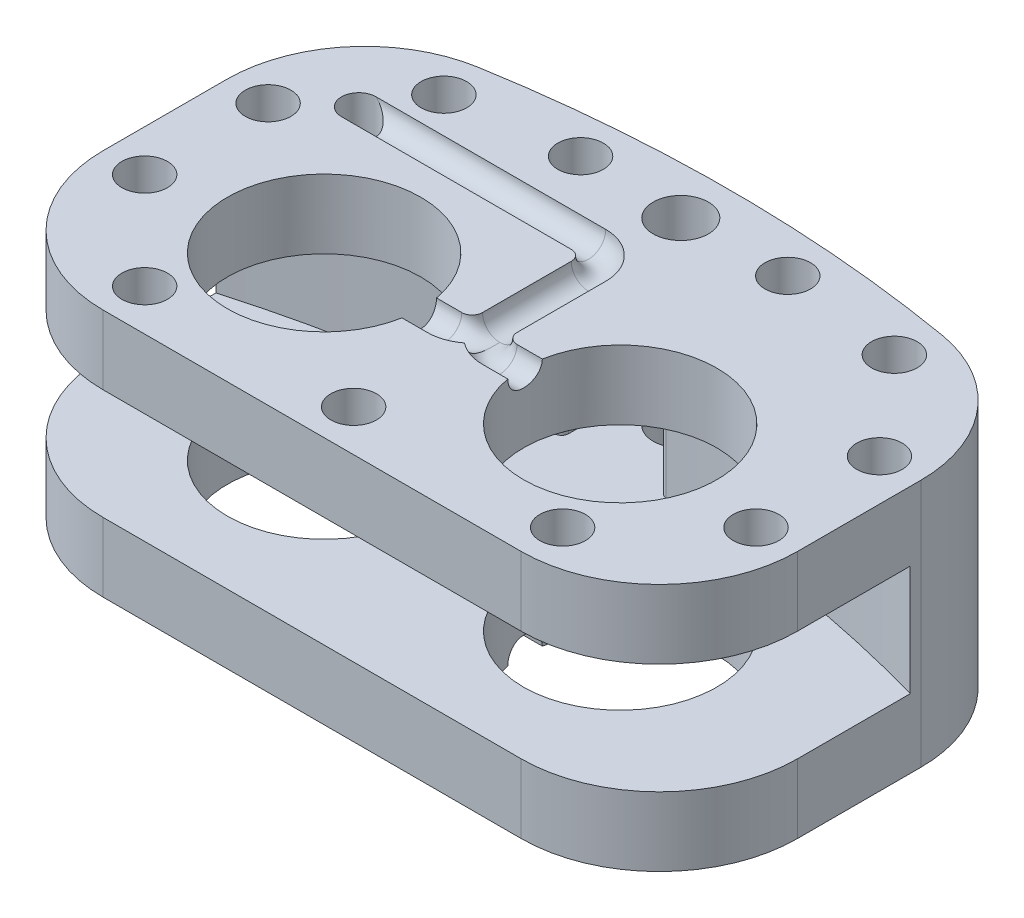
from build123d import *

# Parameters (mm, degrees)
BOSS_EXTRUDE1_DEPTH             = 5
F_12_0MM_DOWEL_HOLE1_D          = 14
BOSS_EXTRUDE2_DEPTH             = 4
F_4_0MM_DOWEL_HOLE1_D           = 4
SKETCH13_R                      = 1.25
SKETCH13_4_R                    = 1.25
M4X0_7_TAPPED_HOLE2_D           = 3.3
M4X0_7_TAPPED_HOLE2_DEPTH       = 8
M4X0_7_TAPPED_HOLE2_TIP         = 0.991420021
FILLET1_R                       = 10
M4X0_7_TAPPED_HOLE1_AT_2_COUNT  = 2
M4X0_7_TAPPED_HOLE1_AT_2_PITCH  = 25.073446611
M4X0_7_TAPPED_HOLE1_AT_3_COUNT  = 2
M4X0_7_TAPPED_HOLE1_AT_3_PITCH  = 32.930809617
M4X0_7_TAPPED_HOLE1_AT_4_COUNT  = 2
M4X0_7_TAPPED_HOLE1_AT_4_PITCH  = 25.111924527
M4X0_7_TAPPED_HOLE1_AT_5_COUNT  = 2
M4X0_7_TAPPED_HOLE1_AT_5_PITCH  = 22.370502293
M4X0_7_TAPPED_HOLE1_AT_6_COUNT  = 2
M4X0_7_TAPPED_HOLE1_AT_6_PITCH  = 16.667429732
M4X0_7_TAPPED_HOLE1_AT_7_COUNT  = 2
M4X0_7_TAPPED_HOLE1_AT_7_PITCH  = 8.870903554
M4X0_7_TAPPED_HOLE1_AT_8_COUNT  = 2
M4X0_7_TAPPED_HOLE1_AT_8_PITCH  = 23.828688167
M4X0_7_TAPPED_HOLE1_AT_9_COUNT  = 2
M4X0_7_TAPPED_HOLE1_AT_9_PITCH  = 30.686033996
M4X0_7_TAPPED_HOLE1_AT_10_COUNT = 2
M4X0_7_TAPPED_HOLE1_AT_10_PITCH = 34.121383931
M4X0_7_TAPPED_HOLE1_AT_11_COUNT = 2
M4X0_7_TAPPED_HOLE1_AT_11_PITCH = 15
FILLET2_R                       = 0.5


with BuildPart() as part:
    # Sketch2 → Boss-Extrude1 (new body)
    with BuildSketch(Plane(origin=(0, 0, 0), x_dir=(1, 0, 0), z_dir=(0, 1, 0))):
        with BuildLine():
            Line((-25.127648951, 69.819630142), (25.127648951, 69.819630142))
            Line((25.127648951, 69.819630142), (25.127648951, 96.828075976))
            ThreePointArc((25.127648951, 96.828075976), (0, 100.035368941), (-25.127648951, 96.828075976))
            Line((-25.127648951, 96.828075976), (-25.127648951, 69.819630142))
        make_face()
    boss_extrude1 = extrude(amount=BOSS_EXTRUDE1_DEPTH)

    # Ø12.0mm Dowel Hole1 (through all)
    with Locations(Plane(origin=(0, 5, 0), x_dir=(1, 0, 0), z_dir=(0, 1, 0))):
        with Locations((-10.716200381, 81.397623119), (10.716200381, 81.397623119)):
            f_12_0mm_dowel_hole1 = Hole(F_12_0MM_DOWEL_HOLE1_D / 2)

    # Sketch6 → Boss-Extrude2 (add)
    with BuildSketch(Plane(origin=(0, 5, 0), x_dir=(1, 0, 0), z_dir=(0, 1, 0))):
        with BuildLine():
            Line((-3.535368944, 91.431674853), (-3.535368944, 99.972877349))
            ThreePointArc((-3.535368944, 99.972877349), (-14.417509932, 98.990961438), (-25.127648951, 96.828075976))
            Line((-25.127648951, 96.828075976), (-25.127648951, 87.982107603))
            ThreePointArc((-25.127648951, 87.982107603), (-14.434923875, 90.354208384), (-3.535368944, 91.431674853))
        make_face()
        with BuildLine():
            Line((3.535368944, 91.431674853), (3.535368944, 99.972877349))
            ThreePointArc((3.535368944, 99.972877349), (14.417509932, 98.990961438), (25.127648951, 96.828075976))
            Line((25.127648951, 96.828075976), (25.127648951, 87.982107603))
            ThreePointArc((25.127648951, 87.982107603), (14.434923875, 90.354208384), (3.535368944, 91.431674853))
        make_face()
    boss_extrude2 = extrude(amount=BOSS_EXTRUDE2_DEPTH)

    # Ø4.0mm Dowel Hole1 (through all)
    with Locations(Plane(origin=(0, 5, 0), x_dir=(1, 0, 0), z_dir=(0, 1, 0))):
        with Locations((0, 96.5)):
            f_4_0mm_dowel_hole1 = Hole(F_4_0MM_DOWEL_HOLE1_D / 2)

    # Cut-Sweep6: sweep along a curve in space
    with BuildLine() as cut_sweep6_path:
        Line((2, 0, -81.397623119), (10.716200381, 0, -81.397623119))
        ThreePointArc((0, 0, -83.397623119), (0.585786438, 0, -81.983409556), (2, 0, -81.397623119))
        Line((0, 0, -89.819630142), (0, 0, -83.397623119))
        ThreePointArc((-2, 0, -91.819630142), (-0.585786438, 0, -91.233843704), (0, 0, -89.819630142))
        Line((-18.627648951, 0, -91.819630142), (-2, 0, -91.819630142))
        Line((-18.627648951, 0, -91.819630142), (-18.627648951, 9, -91.819630142))
        Line((-18.627648951, 9, -91.819630142), (-25.127648951, 9, -96.828075976))
    # Sketch13 → Cut-Sweep6 (sweep, cut)
    with BuildSketch(Plane(origin=(-13.627648951, 0, 0), x_dir=(0, 0, -1), z_dir=(1, 0, 0))):
        with Locations((91.819630142, 0)):
            Circle(SKETCH13_R)
    cut_sweep6 = sweep(path=cut_sweep6_path.line, transition=Transition.RIGHT, mode=Mode.SUBTRACT)

    # Cut-Sweep7: sweep along a path in Sketch9
    with BuildLine(Plane.XZ) as cut_sweep7_path:
        Line((-10.716200381, -81.397623119), (-2, -81.397623119))
        ThreePointArc((-2, -81.397623119), (-0.585786438, -81.983409556), (0, -83.397623119))
        Line((0, -83.397623119), (0, -89.819630142))
        ThreePointArc((0, -89.819630142), (-0.585786438, -91.233843704), (-2, -91.819630142))
        Line((-2, -91.819630142), (-18.627648951, -91.819630142))
    # Sketch13<4> → Cut-Sweep7 (sweep, cut)
    with BuildSketch(Plane(origin=(-13.627648951, 0, 0), x_dir=(0, 0, -1), z_dir=(1, 0, 0))):
        with Locations((91.819630142, 0)):
            Circle(SKETCH13_4_R)
    cut_sweep7 = sweep(path=cut_sweep7_path.line, mode=Mode.SUBTRACT)

    # Mirror5: Boss-Extrude2 across plane
    add(boss_extrude2.mirror(Plane.ZX.offset(9)))

    # Mirror6: Boss-Extrude1, Ø12.0mm Dowel Hole1, Ø4.0mm Dowel Hole1, Cut-Sweep6, Cut-Sweep7 across plane
    add(boss_extrude1.mirror(Plane.ZX.offset(9)))
    add(f_12_0mm_dowel_hole1.mirror(Plane.ZX.offset(9)), mode=Mode.SUBTRACT)
    add(f_4_0mm_dowel_hole1.mirror(Plane.ZX.offset(9)), mode=Mode.SUBTRACT)
    add(cut_sweep6.mirror(Plane.ZX.offset(9)), mode=Mode.SUBTRACT)
    add(cut_sweep7.mirror(Plane.ZX.offset(9)), mode=Mode.SUBTRACT)

    # M4x0.7 Tapped Hole2
    with Locations(Plane(origin=(-25.127648951, 9, -96.828075976), x_dir=(-0.6103571912447526, 0, 0.7921263151138311), z_dir=(-0.7921263151138311, 0, -0.6103571912447526))):
        with Locations((0, 0)):
            Hole(M4X0_7_TAPPED_HOLE2_D / 2, depth=M4X0_7_TAPPED_HOLE2_DEPTH)
            with Locations((0, 0, -(M4X0_7_TAPPED_HOLE2_DEPTH + M4X0_7_TAPPED_HOLE2_TIP / 2))):  # 118° drill point
                Cone(0, M4X0_7_TAPPED_HOLE2_D / 2, M4X0_7_TAPPED_HOLE2_TIP, mode=Mode.SUBTRACT)

    # Fillet1
    # the kernel refuses this fillet: 10 mm, written as the material it takes off along each edge
    with BuildSketch(Plane(origin=(25.127648951, 43, -69.819630142), x_dir=(0, 0, -1), z_dir=(0, -1, 0)), Plane(origin=(-25.127648951, -25, -69.819630142), x_dir=(0, 0, -1), z_dir=(0, 1, 0))) as fillet1_piece_1:
        with BuildLine():
            CenterArc((FILLET1_R, -FILLET1_R), FILLET1_R, 90, 90)
            Line((0, -FILLET1_R), (0, 0))
            Line((0, 0), (FILLET1_R, 0))
        make_face()
    extrude(amount=55, mode=Mode.SUBTRACT)
    with BuildSketch(Plane(origin=(-25.127648951, 43, -69.819630142), x_dir=(0, 0, -1), z_dir=(0, -1, 0)), Plane(origin=(25.127648951, -25, -69.819630142), x_dir=(0, 0, -1), z_dir=(0, 1, 0))) as fillet1_piece_2:
        with BuildLine():
            CenterArc((FILLET1_R, FILLET1_R), FILLET1_R, 180, 90)
            Line((0, FILLET1_R), (0, 0))
            Line((0, 0), (FILLET1_R, 0))
        make_face()
    extrude(amount=55, mode=Mode.SUBTRACT)
    with BuildSketch(Plane(origin=(-25.127648951, 39.272938342, -96.828075976), x_dir=(0, 0, 1), z_dir=(0, -1, 0)), Plane(origin=(-25.127648951, 28.622938342, -96.828075976), x_dir=(0, 0, 1), z_dir=(0, -1, 0))) as fillet1_piece_3:
        with BuildLine():
            CenterArc((8.072671085, -10), FILLET1_R, 90, 80.327342931)
            ThreePointArc((-1.785166556, -8.319810411), (-0.981085437, -4.140915459), (0, 0))
            Line((0, 0), (8.072671085, 0))
        make_face()
    extrude(amount=49.895876684, mode=Mode.SUBTRACT)
    with BuildSketch(Plane(origin=(25.127648951, 39.272938342, -96.828075976), x_dir=(0, 0, 1), z_dir=(0, -1, 0))) as fillet1_piece_4:
        with BuildLine():
            CenterArc((8.072671085, 10), FILLET1_R, 189.672657069, 80.327342931)
            ThreePointArc((-1.785166556, 8.319810411), (-0.981085437, 4.140915459), (0, 0))
            Line((0, 0), (8.072671085, 0))
        make_face()
    extrude(amount=60.545876684, mode=Mode.SUBTRACT)

    # Sketch12 → M4x0.7 Tapped Hole1 (revolve, cut)
    with BuildSketch(Plane(origin=(7.5, 0, -96.745091997), x_dir=(0, 0, -1), z_dir=(1, 0, 0))):
        Polygon((0, 0), (0, 3.491420021), (1.65, 2.5), (1.65, 0), align=None)
    m4x0_7_tapped_hole1 = revolve(axis=Axis((7.5, -6.35, -96.745091997), (0, 1, 0)), mode=Mode.SUBTRACT)

    # M4x0.7 Tapped Hole1 at 2: M4x0.7 Tapped Hole1 ×2
    with Locations(*[Vector(-0.2991212223978009, 0, 0.9542151195151152) * (i * M4X0_7_TAPPED_HOLE1_AT_2_PITCH) for i in range(1, M4X0_7_TAPPED_HOLE1_AT_2_COUNT)]):
        add(m4x0_7_tapped_hole1, mode=Mode.SUBTRACT)

    # M4x0.7 Tapped Hole1 at 3: M4x0.7 Tapped Hole1 ×2
    with Locations(*[Vector(-0.6871270161445325, 0, 0.7265373105934144) * (i * M4X0_7_TAPPED_HOLE1_AT_3_PITCH) for i in range(1, M4X0_7_TAPPED_HOLE1_AT_3_COUNT)]):
        add(m4x0_7_tapped_hole1, mode=Mode.SUBTRACT)

    # M4x0.7 Tapped Hole1 at 4: M4x0.7 Tapped Hole1 ×2
    with Locations(*[Vector(0.3037460925290886, 0, 0.9527530169321483) * (i * M4X0_7_TAPPED_HOLE1_AT_4_PITCH) for i in range(1, M4X0_7_TAPPED_HOLE1_AT_4_COUNT)]):
        add(m4x0_7_tapped_hole1, mode=Mode.SUBTRACT)

    # M4x0.7 Tapped Hole1 at 5: M4x0.7 Tapped Hole1 ×2
    with Locations(*[Vector(0.6538811136083568, 0, 0.7565973098460602) * (i * M4X0_7_TAPPED_HOLE1_AT_5_PITCH) for i in range(1, M4X0_7_TAPPED_HOLE1_AT_5_COUNT)]):
        add(m4x0_7_tapped_hole1, mode=Mode.SUBTRACT)

    # M4x0.7 Tapped Hole1 at 6: M4x0.7 Tapped Hole1 ×2
    with Locations(*[Vector(0.8776187562376473, 0, 0.4793592793509739) * (i * M4X0_7_TAPPED_HOLE1_AT_6_PITCH) for i in range(1, M4X0_7_TAPPED_HOLE1_AT_6_COUNT)]):
        add(m4x0_7_tapped_hole1, mode=Mode.SUBTRACT)

    # M4x0.7 Tapped Hole1 at 7: M4x0.7 Tapped Hole1 ×2
    with Locations(*[Vector(0.9924334775780699, 0, 0.12278351918029798) * (i * M4X0_7_TAPPED_HOLE1_AT_7_PITCH) for i in range(1, M4X0_7_TAPPED_HOLE1_AT_7_COUNT)]):
        add(m4x0_7_tapped_hole1, mode=Mode.SUBTRACT)

    # M4x0.7 Tapped Hole1 at 8: M4x0.7 Tapped Hole1 ×2
    with Locations(*[Vector(-0.9989547681528992, 0, 0.04570963995250205) * (i * M4X0_7_TAPPED_HOLE1_AT_8_PITCH) for i in range(1, M4X0_7_TAPPED_HOLE1_AT_8_COUNT)]):
        add(m4x0_7_tapped_hole1, mode=Mode.SUBTRACT)

    # M4x0.7 Tapped Hole1 at 9: M4x0.7 Tapped Hole1 ×2
    with Locations(*[Vector(-0.9655092266057976, 0, 0.2603688409527429) * (i * M4X0_7_TAPPED_HOLE1_AT_9_PITCH) for i in range(1, M4X0_7_TAPPED_HOLE1_AT_9_COUNT)]):
        add(m4x0_7_tapped_hole1, mode=Mode.SUBTRACT)

    # M4x0.7 Tapped Hole1 at 10: M4x0.7 Tapped Hole1 ×2
    with Locations(*[Vector(-0.868301502984496, 0, 0.49603679290438246) * (i * M4X0_7_TAPPED_HOLE1_AT_10_PITCH) for i in range(1, M4X0_7_TAPPED_HOLE1_AT_10_COUNT)]):
        add(m4x0_7_tapped_hole1, mode=Mode.SUBTRACT)

    # M4x0.7 Tapped Hole1 at 11: M4x0.7 Tapped Hole1 ×2
    with Locations(*[(-i * M4X0_7_TAPPED_HOLE1_AT_11_PITCH, 0, 0) for i in range(1, M4X0_7_TAPPED_HOLE1_AT_11_COUNT)]):
        add(m4x0_7_tapped_hole1, mode=Mode.SUBTRACT)

    # Mirror7: M4x0.7 Tapped Hole1 across plane
    add(m4x0_7_tapped_hole1.mirror(Plane.ZX.offset(9)), mode=Mode.SUBTRACT)

    # Mirror7 copy 1 sketch → Mirror7 copy 1 (revolve, cut)
    with BuildSketch(Plane(origin=(0, 18, -72.819630142), x_dir=(0, 0, -1), z_dir=(1, 0, 0))):
        Polygon((0, 0), (0, -3.491420021), (1.65, -2.5), (1.65, 0), align=None)
    revolve(axis=Axis((0, 24.35, -72.819630142), (0, 1, 0)), mode=Mode.SUBTRACT)

    # Mirror7 copy 2 sketch → Mirror7 copy 2 (revolve, cut)
    with BuildSketch(Plane(origin=(-15.127648951, 18, -72.819630142), x_dir=(0, 0, -1), z_dir=(1, 0, 0))):
        Polygon((0, 0), (0, -3.491420021), (1.65, -2.5), (1.65, 0), align=None)
    revolve(axis=Axis((-15.127648951, 24.35, -72.819630142), (0, 1, 0)), mode=Mode.SUBTRACT)

    # Mirror7 copy 3 sketch → Mirror7 copy 3 (revolve, cut)
    with BuildSketch(Plane(origin=(15.127648951, 18, -72.819630142), x_dir=(0, 0, -1), z_dir=(1, 0, 0))):
        Polygon((0, 0), (0, -3.491420021), (1.65, -2.5), (1.65, 0), align=None)
    revolve(axis=Axis((15.127648951, 24.35, -72.819630142), (0, 1, 0)), mode=Mode.SUBTRACT)

    # Mirror7 copy 4 sketch → Mirror7 copy 4 (revolve, cut)
    with BuildSketch(Plane(origin=(22.127648951, 18, -79.819630142), x_dir=(0, 0, -1), z_dir=(1, 0, 0))):
        Polygon((0, 0), (0, -3.491420021), (1.65, -2.5), (1.65, 0), align=None)
    revolve(axis=Axis((22.127648951, 24.35, -79.819630142), (0, 1, 0)), mode=Mode.SUBTRACT)

    # Mirror7 copy 5 sketch → Mirror7 copy 5 (revolve, cut)
    with BuildSketch(Plane(origin=(22.127648951, 18, -88.755404892), x_dir=(0, 0, -1), z_dir=(1, 0, 0))):
        Polygon((0, 0), (0, -3.491420021), (1.65, -2.5), (1.65, 0), align=None)
    revolve(axis=Axis((22.127648951, 24.35, -88.755404892), (0, 1, 0)), mode=Mode.SUBTRACT)

    # Mirror7 copy 6 sketch → Mirror7 copy 6 (revolve, cut)
    with BuildSketch(Plane(origin=(16.303781663, 18, -95.65589124), x_dir=(0, 0, -1), z_dir=(1, 0, 0))):
        Polygon((0, 0), (0, -3.491420021), (1.65, -2.5), (1.65, 0), align=None)
    revolve(axis=Axis((16.303781663, 24.35, -95.65589124), (0, 1, 0)), mode=Mode.SUBTRACT)

    # Mirror7 copy 7 sketch → Mirror7 copy 7 (revolve, cut)
    with BuildSketch(Plane(origin=(-16.303781663, 18, -95.65589124), x_dir=(0, 0, -1), z_dir=(1, 0, 0))):
        Polygon((0, 0), (0, -3.491420021), (1.65, -2.5), (1.65, 0), align=None)
    revolve(axis=Axis((-16.303781663, 24.35, -95.65589124), (0, 1, 0)), mode=Mode.SUBTRACT)

    # Mirror7 copy 8 sketch → Mirror7 copy 8 (revolve, cut)
    with BuildSketch(Plane(origin=(-22.127648951, 18, -88.755404892), x_dir=(0, 0, -1), z_dir=(1, 0, 0))):
        Polygon((0, 0), (0, -3.491420021), (1.65, -2.5), (1.65, 0), align=None)
    revolve(axis=Axis((-22.127648951, 24.35, -88.755404892), (0, 1, 0)), mode=Mode.SUBTRACT)

    # Mirror7 copy 9 sketch → Mirror7 copy 9 (revolve, cut)
    with BuildSketch(Plane(origin=(-22.127648951, 18, -79.819630142), x_dir=(0, 0, -1), z_dir=(1, 0, 0))):
        Polygon((0, 0), (0, -3.491420021), (1.65, -2.5), (1.65, 0), align=None)
    revolve(axis=Axis((-22.127648951, 24.35, -79.819630142), (0, 1, 0)), mode=Mode.SUBTRACT)

    # Mirror7 copy 10 sketch → Mirror7 copy 10 (revolve, cut)
    with BuildSketch(Plane(origin=(-7.5, 18, -96.745091997), x_dir=(0, 0, -1), z_dir=(1, 0, 0))):
        Polygon((0, 0), (0, -3.491420021), (1.65, -2.5), (1.65, 0), align=None)
    revolve(axis=Axis((-7.5, 24.35, -96.745091997), (0, 1, 0)), mode=Mode.SUBTRACT)

    # Fillet2
    fillet2_edges = [part.edges().sort_by_distance(p)[0] for p in [
        (-3.535368944, 9, -91.431674853),
        (3.535368944, 9, -91.431674853),
    ]]
    fillet(fillet2_edges, radius=FILLET2_R)


solid = part.part
